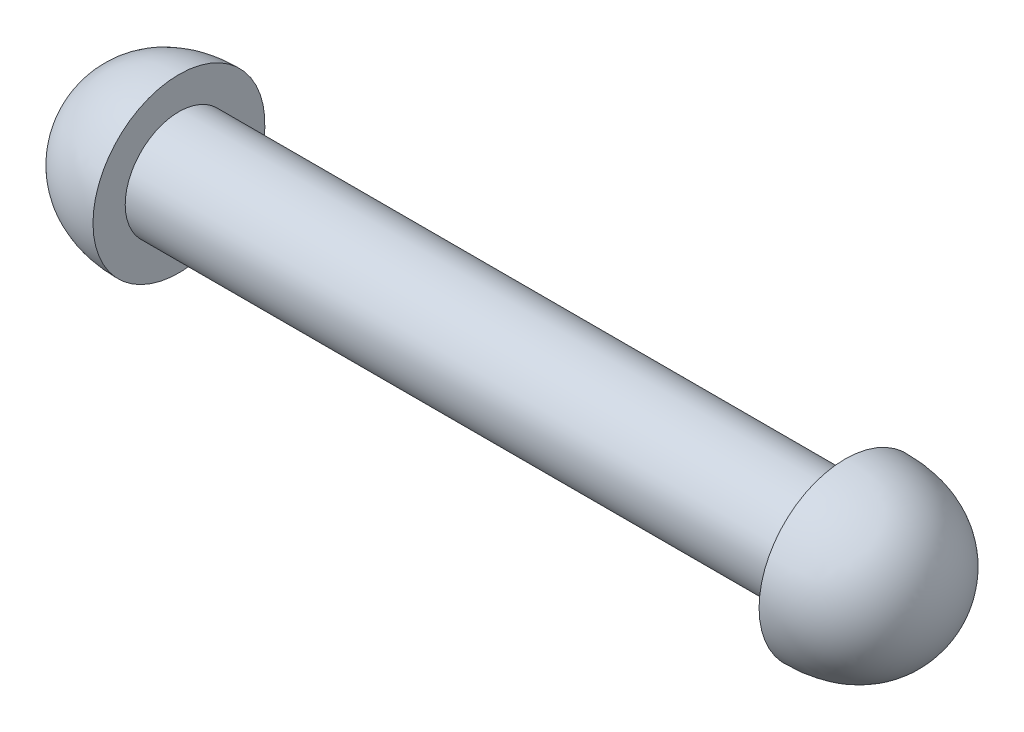
from build123d import *

# Parameters (mm, degrees)
SKETCH1_R           = 25
BOSS_EXTRUDE1_DEPTH = 155


with BuildPart() as part:
    # Sketch1 → Boss-Extrude1 (new body)
    with BuildSketch(Plane(origin=(0, 0, 0), x_dir=(0, 0, -1), z_dir=(1, 0, 0))):
        Circle(SKETCH1_R)
    boss_extrude1 = extrude(amount=BOSS_EXTRUDE1_DEPTH)

    # Sketch3 → Revolve1 (revolve)
    with BuildSketch(Plane.XY):
        with BuildLine():
            Line((0, 0), (-45.458392513, 0))
            add(Edge.make_bspline(
                [(-45.458392513, 0), (-45.458392513, 20.183781855), (-30.991238831, 40), (0, 40)],
                knots=[0, 0, 0, 0, 1, 1, 1, 1], degree=3))
            Line((0, 40), (0, 0))
        make_face()
    revolve1 = revolve(axis=Axis((-100.078673334, 0, 0), (1, 0, 0)))

    # Mirror1: Boss-Extrude1, Revolve1 across plane
    add(boss_extrude1.mirror(Plane(origin=(155, 0, 0), x_dir=(0, 0, 1), z_dir=(1, 0, 0))))
    add(revolve1.mirror(Plane(origin=(155, 0, 0), x_dir=(0, 0, 1), z_dir=(1, 0, 0))))


solid = part.part
